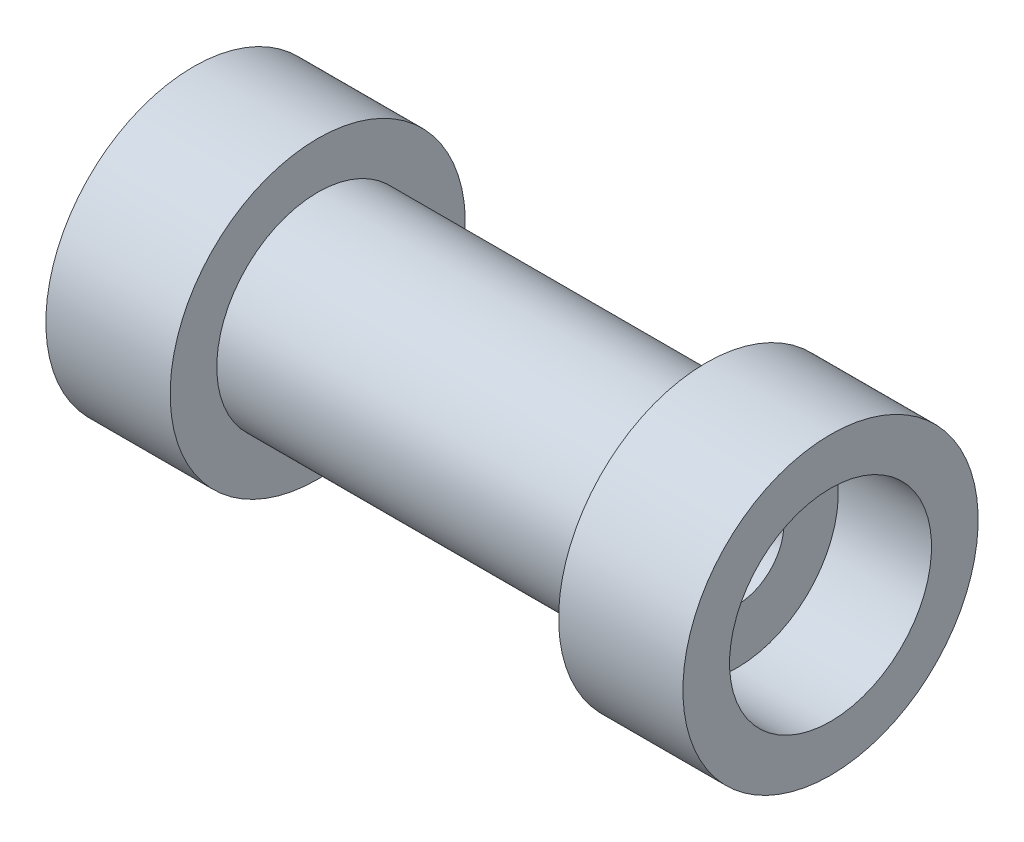
from build123d import *

# Parameters (mm, degrees)
SKETCH2_R          = 3
CUT_EXTRUDE1_DEPTH = 38.489998666


with BuildPart() as part:
    # Sketch1 → Revolve1 (revolve)
    with BuildSketch(Plane.XY):
        Polygon((-12.5, 6.5), (12.5, 6.5), (12.5, 9.5), (20.5, 9.5), (20.5, 6.5), (14.5, 6.5), (14.5, 0), (-14.5, 0), (-14.5, 6.5), (-20.5, 6.5), (-20.5, 9.5), (-12.5, 9.5), align=None)
    revolve(axis=Axis((-14.5, 0, 0), (1, 0, 0)))

    # Sketch2 → Cut-Extrude1 (cut, through all)
    with BuildSketch(Plane.ZY.offset(14.5)):
        Circle(SKETCH2_R)
    extrude(amount=-CUT_EXTRUDE1_DEPTH, mode=Mode.SUBTRACT)


solid = part.part
